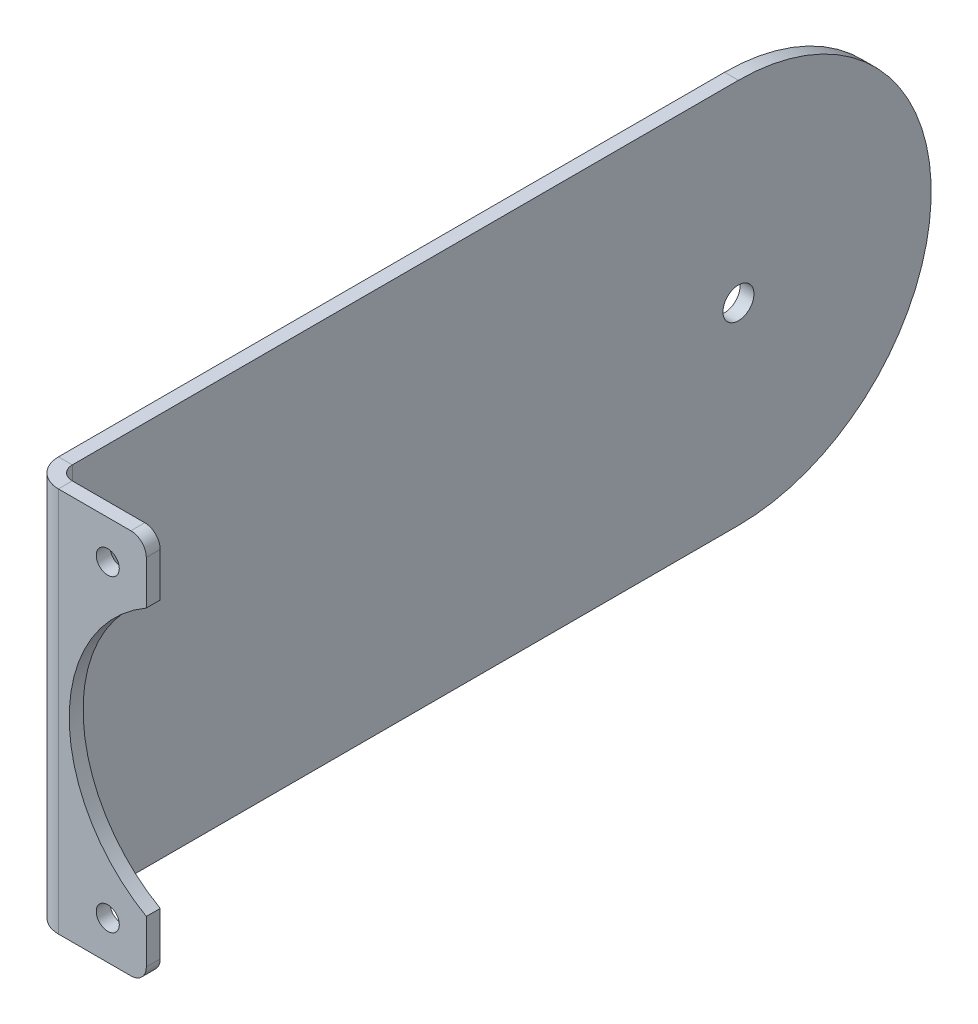
from build123d import *

# Parameters (mm, degrees)
BASE_FLANGE1_DEPTH           = 31.75
SKETCH6_R                    = 25.4
CUT_EXTRUDE1_DEPTH           = 150.764450471
FILLET1_R                    = 2.54
CUT_EXTRUDE2_DEPTH           = 82.875610685
F_7_0_201_DIAMETER_HOLE1_D   = 5.1054
F_25_0_1495_DIAMETER_HOLE1_D = 3.7973


# Sheet-metal steps are written as plain solids
with BuildPart() as part:
    # Sketch1 → Base-Flange1 (new, symmetric)
    with BuildSketch(Plane(origin=(0, 0, 0), x_dir=(-1, 0, 0), z_dir=(0, 1, 0))):
        with BuildLine():
            Line((9.525, -73.025), (9.525, 68.453))
            ThreePointArc((9.525, 68.453), (8.185892204, 71.685892204), (4.953, 73.025))
            Line((4.953, 73.025), (-9.525, 73.025))
            Line((-9.525, 73.025), (-9.525, 70.739))
            Line((-9.525, 70.739), (4.953, 70.739))
            ThreePointArc((4.953, 70.739), (6.569446102, 70.069446102), (7.239, 68.453))
            Line((7.239, 68.453), (7.239, -73.025))
            Line((7.239, -73.025), (9.525, -73.025))
        make_face()
    extrude(amount=BASE_FLANGE1_DEPTH, both=True)

    # Sketch6 → Cut-Extrude1 (cut, through all)
    with BuildSketch(Plane.XY.offset(73.025)):
        with Locations((22.225, 0)):
            Circle(SKETCH6_R)
    extrude(amount=-CUT_EXTRUDE1_DEPTH, mode=Mode.SUBTRACT)

    # Fillet1
    fillet1_edges = [part.edges().sort_by_distance(p)[0] for p in [
        (9.525, 31.75, 71.882),
        (9.525, -31.75, 71.882),
    ]]
    fillet(fillet1_edges, radius=FILLET1_R)

    # Sketch7 → Cut-Extrude2 (cut, through all)
    with BuildSketch(Plane(origin=(-9.525, 0, 0), x_dir=(0, -1, 0), z_dir=(-1, 0, 0))):
        with BuildLine():
            Line((-31.75, -41.275), (-31.75, -92.075))
            Line((-31.75, -92.075), (31.75, -92.075))
            Line((31.75, -92.075), (31.75, -41.275))
            ThreePointArc((31.75, -41.275), (0, -73.025), (-31.75, -41.275))
        make_face()
    extrude(amount=-CUT_EXTRUDE2_DEPTH, mode=Mode.SUBTRACT)

    # #7 (0.201) Diameter Hole1 (through all)
    with Locations(Plane.ZY.offset(9.525)):
        with Locations((-41.275, 0)):
            Hole(F_7_0_201_DIAMETER_HOLE1_D / 2)

    # #25 (0.1495) Diameter Hole1 (through all)
    with Locations(Plane.XY.offset(73.025)):
        with Locations((3.175, 25.4), (3.175, -25.4)):
            Hole(F_25_0_1495_DIAMETER_HOLE1_D / 2)


solid = part.part
